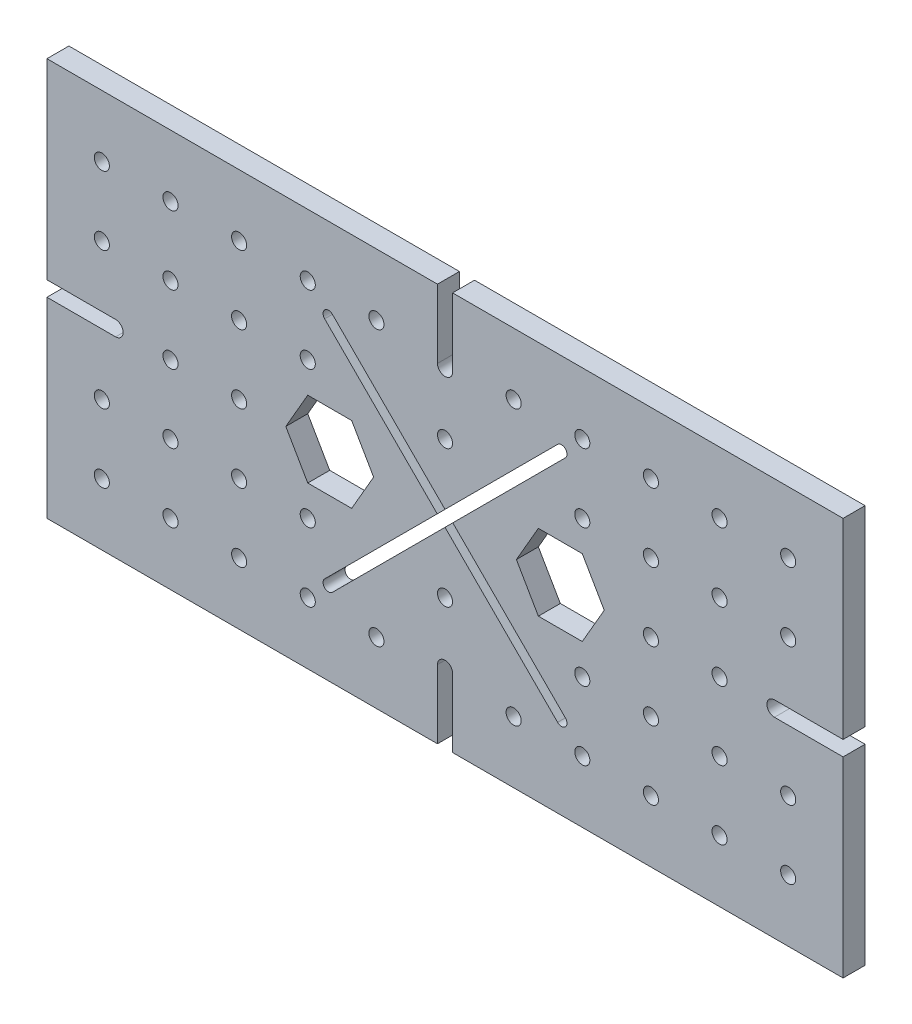
from build123d import *

# Parameters (mm, degrees)
BOSS_EXTRUDE1_DEPTH     = 8
FILL_PATTERN1_OUTLINE_R = 2.75
FILL_PATTERN1_DEPTH     = 8


# Read off the part's stored shape, not the designer's step: Fill Pattern1
with BuildPart() as part:
    # Sketch1 → Boss-Extrude1 (new body)
    with BuildSketch(Plane.XY):
        with BuildLine():
            Line((-145, -2.75), (-145, -72.5))
            Line((-145, -72.5), (-2.75, -72.5))
            Line((-2.75, -72.5), (-2.75, -47.5))
            ThreePointArc((-2.75, -47.5), (0, -44.75), (2.75, -47.5))
            Line((2.75, -47.5), (2.75, -72.5))
            Line((2.75, -72.5), (145, -72.5))
            Line((145, -72.5), (145, -2.75))
            Line((145, -2.75), (120, -2.75))
            ThreePointArc((120, -2.75), (117.25, 0), (120, 2.75))
            Line((120, 2.75), (145, 2.75))
            Line((145, 2.75), (145, 72.5))
            Line((145, 72.5), (2.75, 72.5))
            Line((2.75, 72.5), (2.75, 47.5))
            ThreePointArc((2.75, 47.5), (0, 44.75), (-2.75, 47.5))
            Line((-2.75, 47.5), (-2.75, 72.5))
            Line((-2.75, 72.5), (-145, 72.5))
            Line((-145, 72.5), (-145, 2.75))
            Line((-145, 2.75), (-120, 2.75))
            ThreePointArc((-120, 2.75), (-117.25, 0), (-120, -2.75))
            Line((-120, -2.75), (-145, -2.75))
        make_face()
        with BuildLine():
            ThreePointArc((-43.840620434, 41.012193309), (-43.840620434, 43.840620434), (-41.012193309, 43.840620434))
            Line((-41.012193309, 43.840620434), (0, 2.828427125))
            Line((0, 2.828427125), (41.012193309, 43.840620434))
            ThreePointArc((41.012193309, 43.840620434), (43.840620434, 43.840620434), (43.840620434, 41.012193309))
            Line((43.840620434, 41.012193309), (2.828427125, 0))
            Line((2.828427125, 0), (43.840620434, -41.012193309))
            ThreePointArc((43.840620434, -41.012193309), (43.840620434, -43.840620434), (41.012193309, -43.840620434))
            Line((41.012193309, -43.840620434), (0, -2.828427125))
            Line((0, -2.828427125), (-41.012193309, -43.840620434))
            ThreePointArc((-41.012193309, -43.840620434), (-43.840620434, -43.840620434), (-43.840620434, -41.012193309))
            Line((-43.840620434, -41.012193309), (-2.828427125, 0))
            Line((-2.828427125, 0), (-43.840620434, 41.012193309))
        make_face(mode=Mode.SUBTRACT)
        Polygon((-50, -13.856406461), (-58, 0), (-50, 13.856406461), (-34, 13.856406461), (-26, 0), (-34, -13.856406461), align=None, mode=Mode.SUBTRACT)
        Polygon((50, 13.856406461), (58, 0), (50, -13.856406461), (34, -13.856406461), (26, 0), (34, 13.856406461), align=None, mode=Mode.SUBTRACT)
    extrude(amount=BOSS_EXTRUDE1_DEPTH)

    # Fill Pattern1 outline → Fill Pattern1 (cut)
    with BuildSketch(Plane.XY):
        with Locations((50, 50)):
            Circle(FILL_PATTERN1_OUTLINE_R)
        with Locations((-50, 25)):
            Circle(FILL_PATTERN1_OUTLINE_R)
        with Locations((-50, -25)):
            Circle(FILL_PATTERN1_OUTLINE_R)
        with Locations((-50, -50)):
            Circle(FILL_PATTERN1_OUTLINE_R)
        with Locations((125, -50)):
            Circle(FILL_PATTERN1_OUTLINE_R)
        with Locations((-25, -50)):
            Circle(FILL_PATTERN1_OUTLINE_R)
        with Locations((0, 25)):
            Circle(FILL_PATTERN1_OUTLINE_R)
        with Locations((125, -25)):
            Circle(FILL_PATTERN1_OUTLINE_R)
        with Locations((100, -50)):
            Circle(FILL_PATTERN1_OUTLINE_R)
        with Locations((25, 50)):
            Circle(FILL_PATTERN1_OUTLINE_R)
        with Locations((-75, 0)):
            Circle(FILL_PATTERN1_OUTLINE_R)
        with Locations((-75, 25)):
            Circle(FILL_PATTERN1_OUTLINE_R)
        with Locations((-75, 50)):
            Circle(FILL_PATTERN1_OUTLINE_R)
        with Locations((-75, -25)):
            Circle(FILL_PATTERN1_OUTLINE_R)
        with Locations((-75, -50)):
            Circle(FILL_PATTERN1_OUTLINE_R)
        with Locations((-25, 50)):
            Circle(FILL_PATTERN1_OUTLINE_R)
        with Locations((-50, 50)):
            Circle(FILL_PATTERN1_OUTLINE_R)
        with Locations((100, 25)):
            Circle(FILL_PATTERN1_OUTLINE_R)
        with Locations((75, 0)):
            Circle(FILL_PATTERN1_OUTLINE_R)
        with Locations((50, -25)):
            Circle(FILL_PATTERN1_OUTLINE_R)
        with Locations((0, -25)):
            Circle(FILL_PATTERN1_OUTLINE_R)
        with Locations((50, 25)):
            Circle(FILL_PATTERN1_OUTLINE_R)
        with Locations((75, 50)):
            Circle(FILL_PATTERN1_OUTLINE_R)
        with Locations((75, 25)):
            Circle(FILL_PATTERN1_OUTLINE_R)
        with Locations((100, 50)):
            Circle(FILL_PATTERN1_OUTLINE_R)
        with Locations((125, 25)):
            Circle(FILL_PATTERN1_OUTLINE_R)
        with Locations((25, -50)):
            Circle(FILL_PATTERN1_OUTLINE_R)
        with Locations((75, -50)):
            Circle(FILL_PATTERN1_OUTLINE_R)
        with Locations((100, -25)):
            Circle(FILL_PATTERN1_OUTLINE_R)
        with Locations((125, 50)):
            Circle(FILL_PATTERN1_OUTLINE_R)
        with Locations((50, -50)):
            Circle(FILL_PATTERN1_OUTLINE_R)
        with Locations((75, -25)):
            Circle(FILL_PATTERN1_OUTLINE_R)
        with Locations((100, 0)):
            Circle(FILL_PATTERN1_OUTLINE_R)
        with Locations((-125, 50)):
            Circle(FILL_PATTERN1_OUTLINE_R)
        with Locations((-100, -50)):
            Circle(FILL_PATTERN1_OUTLINE_R)
        with Locations((-100, -25)):
            Circle(FILL_PATTERN1_OUTLINE_R)
        with Locations((-100, 0)):
            Circle(FILL_PATTERN1_OUTLINE_R)
        with Locations((-100, 25)):
            Circle(FILL_PATTERN1_OUTLINE_R)
        with Locations((-125, 25)):
            Circle(FILL_PATTERN1_OUTLINE_R)
        with Locations((-125, -25)):
            Circle(FILL_PATTERN1_OUTLINE_R)
        with Locations((-125, -50)):
            Circle(FILL_PATTERN1_OUTLINE_R)
        with Locations((-100, 50)):
            Circle(FILL_PATTERN1_OUTLINE_R)
    extrude(amount=FILL_PATTERN1_DEPTH, mode=Mode.SUBTRACT)


solid = part.part
